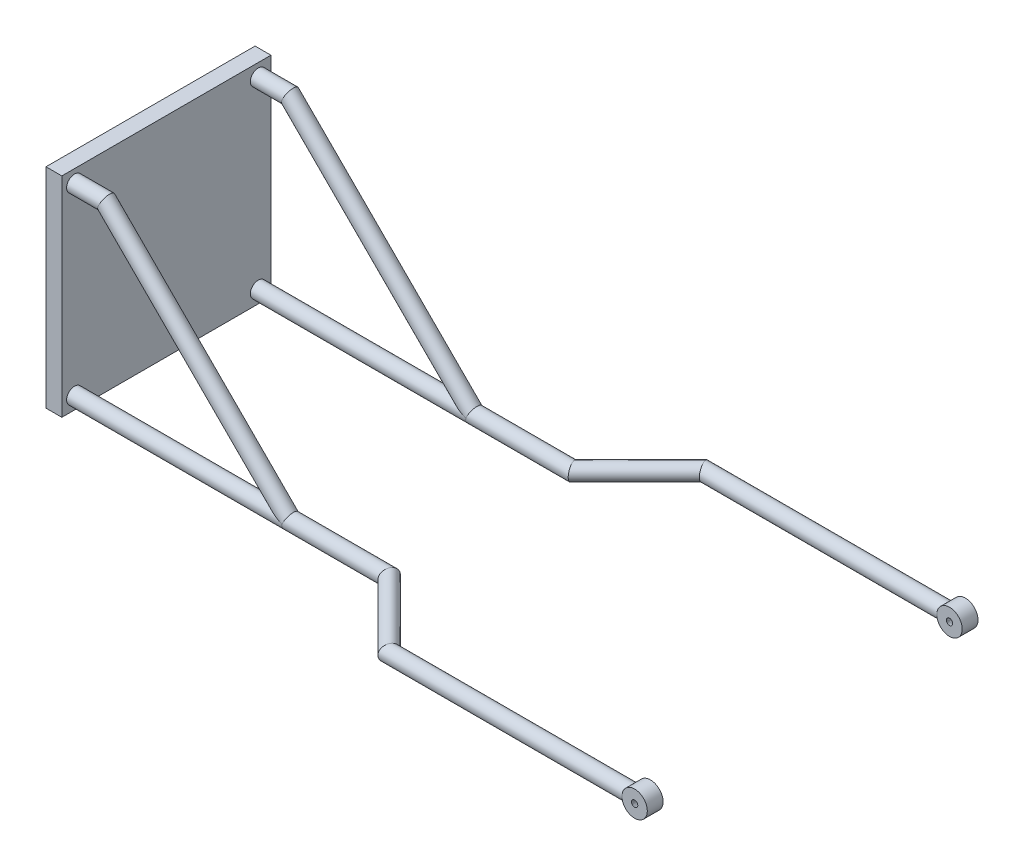
from build123d import *

# Parameters (mm, degrees)
ESBO_O1_W                  = 66
ESBO_O1_H                  = 66
ESBO_O1_R                  = 2.5
RESSALTO_EXTRUS_O1_DEPTH   = 5
ESBO_O3_R                  = 2.5
ESBO_O5_R                  = 2.5
RESSALTO_EXTRUS_O2_START   = -20.7
ESBO_O4_R                  = 4
RESSALTO_EXTRUS_O2_DEPTH   = 2.5
CORTE_EXTRUS_O1_DEPTH      = 226.303883677
CORTE_EXTRUS_O1_DEPTH_BACK = 226.303883677
ESBO_O6_R                  = 1


with BuildPart() as part:
    # Esboço1 → Ressalto-extrusão1 (new body)
    with BuildSketch(Plane(origin=(0, 0, 0), x_dir=(0, 0, -1), z_dir=(1, 0, 0))):
        with Locations((0, 33)):
            Rectangle(ESBO_O1_W, ESBO_O1_H)
        with Locations((-29, 62)):
            Circle(ESBO_O1_R, mode=Mode.SUBTRACT)
        with Locations((-29, 4)):
            Circle(ESBO_O1_R, mode=Mode.SUBTRACT)
        with Locations((29, 4)):
            Circle(ESBO_O1_R, mode=Mode.SUBTRACT)
        with Locations((29, 62)):
            Circle(ESBO_O1_R, mode=Mode.SUBTRACT)
    extrude(amount=RESSALTO_EXTRUS_O1_DEPTH)


with BuildPart() as body_2:
    # Varredura1: sweep along a curve in space
    with BuildLine() as varredura1_path:
        Line((0, 62, 29), (15, 62, 29))
        Line((15, 62, 29), (73, 4, 29))
        Line((73, 4, 29), (104.3, 4, 29))
        Line((104.3, 4, 29), (125, 4, 49.7))
        Line((125, 4, 49.7), (205, 4, 49.7))
    # Esboço3 → Varredura1 (sweep)
    with BuildSketch(Plane(origin=(0, 0, 0), x_dir=(0, 0, -1), z_dir=(1, 0, 0))):
        with Locations((-29, 62)):
            Circle(ESBO_O3_R)
    sweep(path=varredura1_path.line, transition=Transition.RIGHT)


with BuildPart() as body_3:
    # Varredura2: sweep along a curve in space
    with BuildLine() as varredura2_path:
        Line((0, 4, 29), (73, 4, 29))
    # Esboço5 → Varredura2 (sweep)
    with BuildSketch(Plane.ZY):
        with Locations((29, 4)):
            Circle(ESBO_O5_R)
    sweep(path=varredura2_path.line)


with BuildPart() as body_4:
    # Esboço4 → Ressalto-extrusão2 (new, symmetric)
    with BuildSketch(Plane(origin=(0, 0, 29), x_dir=(-1, 0, 0), z_dir=(0, 0, -1)).offset(RESSALTO_EXTRUS_O2_START)):
        with Locations((-205, 4)):
            Circle(ESBO_O4_R)
    extrude(amount=RESSALTO_EXTRUS_O2_DEPTH, both=True)


with BuildPart() as body_5:
    # Espelhar1: mirrored copy
    add(body_2.part.mirror(Plane.XY))


with BuildPart() as body_6:
    # Espelhar1 2: mirrored copy
    add(body_3.part.mirror(Plane.XY))


with BuildPart() as body_7:
    # Espelhar1 3: mirrored copy
    add(body_4.part.mirror(Plane.XY))


with BuildPart() as corte_extrus_o1_tool:
    # Esboço6 → Corte-extrusão1 (new, two sides: drawn at the far end of the back side and taken through both)
    with BuildSketch(Plane.XY.offset(-CORTE_EXTRUS_O1_DEPTH_BACK)):
        with Locations((205, 4)):
            Circle(ESBO_O6_R)
    extrude(amount=CORTE_EXTRUS_O1_DEPTH + CORTE_EXTRUS_O1_DEPTH_BACK)


with BuildPart() as body_2_1:
    add(body_2.part)

    # Corte-extrusão1: cut by corte_extrus_o1_tool
    add(corte_extrus_o1_tool.part, mode=Mode.SUBTRACT)


with BuildPart() as body_4_1:
    add(body_4.part)

    # Corte-extrusão1: cut by corte_extrus_o1_tool
    add(corte_extrus_o1_tool.part, mode=Mode.SUBTRACT)


with BuildPart() as body_5_1:
    add(body_5.part)

    # Corte-extrusão1: cut by corte_extrus_o1_tool
    add(corte_extrus_o1_tool.part, mode=Mode.SUBTRACT)


with BuildPart() as body_7_1:
    add(body_7.part)

    # Corte-extrusão1: cut by corte_extrus_o1_tool
    add(corte_extrus_o1_tool.part, mode=Mode.SUBTRACT)


solid = Compound([part.part, body_3.part, body_6.part, body_2_1.part, body_4_1.part, body_5_1.part, body_7_1.part])
